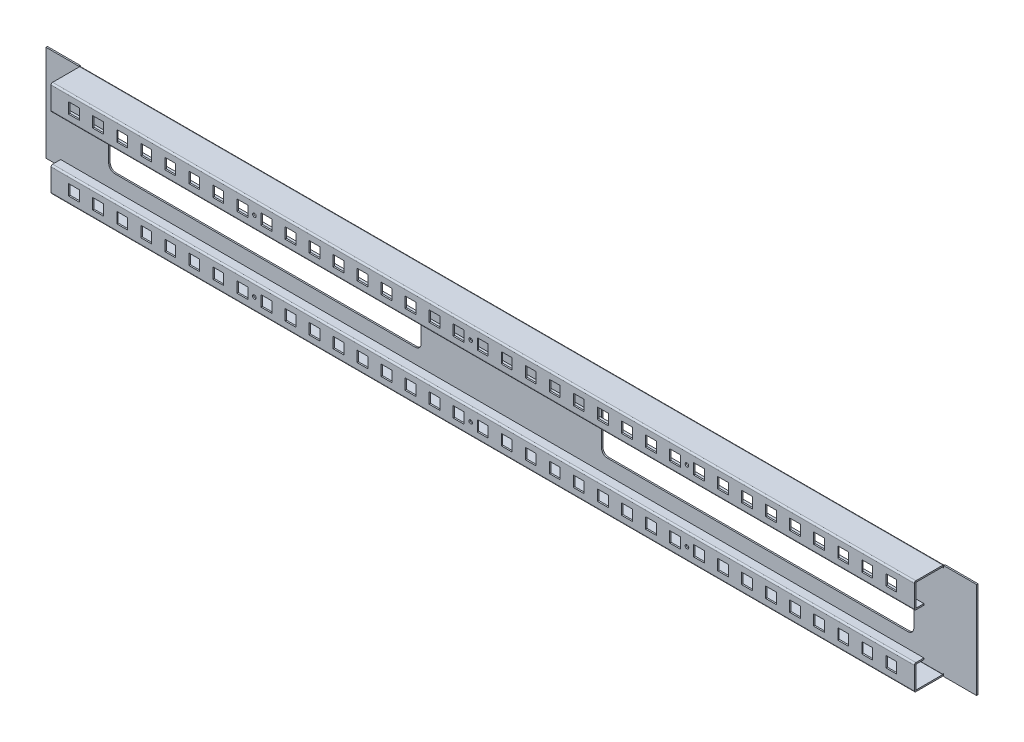
from build123d import *

# Parameters (mm, degrees)
SKETCH_1_W                          = 774.4
SKETCH_1_H                          = 80
SM_BASE_FLANGE_1_DEPTH              = 1.2
SM_EDGE_FLANGE_1_STRIP_W            = 5
SM_EDGE_FLANGE_1_STRIP_H            = 1.2
SM_EDGE_FLANGE_1_STRIP_CUT_DEPTH    = 718.4
SM_EDGE_FLANGE_1_RELIEF_W           = 5.6
SM_EDGE_FLANGE_1_RELIEF_H           = 0.6
SM_EDGE_FLANGE_1_RELIEF_CUT_DEPTH   = 1.2
SM_EDGE_FLANGE_1_STRIP_2_W          = 5
SM_EDGE_FLANGE_1_STRIP_2_H          = 1.2
SM_EDGE_FLANGE_1_STRIP_CUT_2_DEPTH  = 718.4
SM_EDGE_FLANGE_1_RELIEF_2_W         = 5.6
SM_EDGE_FLANGE_1_RELIEF_2_H         = 0.6
SM_EDGE_FLANGE_1_RELIEF_CUT_2_DEPTH = 1.2
SM_EDGE_FLANGE_1_DEPTH              = 718.4
SM_EDGE_FLANGE_1_BEND_DEPTH         = 718.4
SM_EDGE_FLANGE_2_STRIP_W            = 5
SM_EDGE_FLANGE_2_STRIP_H            = 1.2
SM_EDGE_FLANGE_2_STRIP_CUT_DEPTH    = 718.4
SM_EDGE_FLANGE_2_STRIP_2_W          = 5
SM_EDGE_FLANGE_2_STRIP_2_H          = 1.2
SM_EDGE_FLANGE_2_STRIP_CUT_2_DEPTH  = 718.4
SM_EDGE_FLANGE_2_DEPTH              = 718.4
SM_EDGE_FLANGE_2_BEND_DEPTH         = 718.4
SM_EDGE_FLANGE_3_STRIP_W            = 5
SM_EDGE_FLANGE_3_STRIP_H            = 1.2
SM_EDGE_FLANGE_3_STRIP_CUT_DEPTH    = 718.4
SM_EDGE_FLANGE_3_STRIP_2_W          = 5
SM_EDGE_FLANGE_3_STRIP_2_H          = 1.2
SM_EDGE_FLANGE_3_STRIP_CUT_2_DEPTH  = 718.4
SM_EDGE_FLANGE_3_DEPTH              = 718.4
SM_EDGE_FLANGE_3_BEND_DEPTH         = 718.4
SKETCH_26_W                         = 9
SKETCH_26_H                         = 9
CUT_EXTRUDE_1_DEPTH                 = 10
PATTERN_LINEAR_1_COUNT              = 18
PATTERN_LINEAR_1_PITCH              = 20
PATTERN_LINEAR_1_COL_COUNT          = 18
PATTERN_LINEAR_1_COL_PITCH          = 20
CUT_EXTRUDE_2_DEPTH                 = 10
SKETCH_28_R                         = 1.5
CUT_EXTRUDE_3_DEPTH                 = 10


# Sheet-metal steps are written as plain solids
with BuildPart() as part:
    # Sketch 1 → 基体-法兰1 (new body)
    with BuildSketch(Plane.XY):
        Rectangle(SKETCH_1_W, SKETCH_1_H)
    extrude(amount=-SM_BASE_FLANGE_1_DEPTH)

    # 边线-法兰1 strip (across the edge) → 边线-法兰1 strip cut (cut)
    with BuildSketch(Plane(origin=(359.2, 40, 0), x_dir=(0, -1, 0), z_dir=(-1, 0, 0))):
        with Locations((-1.2, -0.6)):
            Rectangle(SM_EDGE_FLANGE_1_STRIP_W, SM_EDGE_FLANGE_1_STRIP_H)
    extrude(amount=SM_EDGE_FLANGE_1_STRIP_CUT_DEPTH, mode=Mode.SUBTRACT)

    # 边线-法兰1 relief (on the sheet) → 边线-法兰1 relief cut (cut)
    with BuildSketch(Plane(origin=(359.2, 38.7, 0), x_dir=(0, -1, 0), z_dir=(0, 0, 1))):
        with Locations((-2.2, 0.3)):
            Rectangle(SM_EDGE_FLANGE_1_RELIEF_W, SM_EDGE_FLANGE_1_RELIEF_H)
        with Locations((-2.2, -718.7)):
            Rectangle(SM_EDGE_FLANGE_1_RELIEF_W, SM_EDGE_FLANGE_1_RELIEF_H)
    extrude(amount=-SM_EDGE_FLANGE_1_RELIEF_CUT_DEPTH, mode=Mode.SUBTRACT)

    # 边线-法兰1 strip 2 (across the edge) → 边线-法兰1 strip cut 2 (cut)
    with BuildSketch(Plane(origin=(-359.2, -40, 0), x_dir=(0, 1, 0), z_dir=(1, 0, 0))):
        with Locations((-1.2, -0.6)):
            Rectangle(SM_EDGE_FLANGE_1_STRIP_2_W, SM_EDGE_FLANGE_1_STRIP_2_H)
    extrude(amount=SM_EDGE_FLANGE_1_STRIP_CUT_2_DEPTH, mode=Mode.SUBTRACT)

    # 边线-法兰1 relief 2 (on the sheet) → 边线-法兰1 relief cut 2 (cut)
    with BuildSketch(Plane(origin=(-359.2, -38.7, 0), x_dir=(0, 1, 0), z_dir=(0, 0, 1))):
        with Locations((-2.2, 0.3)):
            Rectangle(SM_EDGE_FLANGE_1_RELIEF_2_W, SM_EDGE_FLANGE_1_RELIEF_2_H)
        with Locations((-2.2, -718.7)):
            Rectangle(SM_EDGE_FLANGE_1_RELIEF_2_W, SM_EDGE_FLANGE_1_RELIEF_2_H)
    extrude(amount=-SM_EDGE_FLANGE_1_RELIEF_CUT_2_DEPTH, mode=Mode.SUBTRACT)

    # 边线-法兰1 section (across the edge) → 边线-法兰1 (add)
    with BuildSketch(Plane(origin=(359.2, 40, 0), x_dir=(0, -1, 0), z_dir=(-1, 0, 0))):
        with BuildLine():
            Line((0, 0.1), (0, 23.8))
            Line((0, 23.8), (1.2, 23.8))
            Line((1.2, 23.8), (1.2, 0.1))
            ThreePointArc((1.2, 0.1), (1.229289322, 0.029289322), (1.3, 0))
            Line((1.3, 0), (1.3, -1.2))
            ThreePointArc((1.3, -1.2), (0.380761184, -0.819238816), (0, 0.1))
        make_face()
    extrude(amount=SM_EDGE_FLANGE_1_DEPTH)

    # 边线-法兰1 section 2 (across the edge) → 边线-法兰1 bend (add)
    with BuildSketch(Plane(origin=(-359.2, -40, 0), x_dir=(0, 1, 0), z_dir=(1, 0, 0))):
        with BuildLine():
            Line((0, 0.1), (0, 23.8))
            Line((0, 23.8), (1.2, 23.8))
            Line((1.2, 23.8), (1.2, 0.1))
            ThreePointArc((1.2, 0.1), (1.229289322, 0.029289322), (1.3, 0))
            Line((1.3, 0), (1.3, -1.2))
            ThreePointArc((1.3, -1.2), (0.380761184, -0.819238816), (0, 0.1))
        make_face()
    extrude(amount=SM_EDGE_FLANGE_1_BEND_DEPTH)

    # 边线-法兰2 strip (across the edge) → 边线-法兰2 strip cut (cut)
    with BuildSketch(Plane(origin=(359.2, 38.8, 23.8), x_dir=(0, 0, -1), z_dir=(-1, 0, 0))):
        with Locations((-1.2, -0.6)):
            Rectangle(SM_EDGE_FLANGE_2_STRIP_W, SM_EDGE_FLANGE_2_STRIP_H)
    extrude(amount=SM_EDGE_FLANGE_2_STRIP_CUT_DEPTH, mode=Mode.SUBTRACT)

    # 边线-法兰2 strip 2 (across the edge) → 边线-法兰2 strip cut 2 (cut)
    with BuildSketch(Plane(origin=(-359.2, -38.8, 23.8), x_dir=(0, 0, -1), z_dir=(1, 0, 0))):
        with Locations((-1.2, -0.6)):
            Rectangle(SM_EDGE_FLANGE_2_STRIP_2_W, SM_EDGE_FLANGE_2_STRIP_2_H)
    extrude(amount=SM_EDGE_FLANGE_2_STRIP_CUT_2_DEPTH, mode=Mode.SUBTRACT)

    # 边线-法兰2 section (across the edge) → 边线-法兰2 (add)
    with BuildSketch(Plane(origin=(359.2, 38.8, 23.8), x_dir=(0, 0, -1), z_dir=(-1, 0, 0))):
        with BuildLine():
            Line((0, 0.1), (0, 19.8))
            Line((0, 19.8), (1.2, 19.8))
            Line((1.2, 19.8), (1.2, 0.1))
            ThreePointArc((1.2, 0.1), (1.229289322, 0.029289322), (1.3, 0))
            Line((1.3, 0), (1.3, -1.2))
            ThreePointArc((1.3, -1.2), (0.380761184, -0.819238816), (0, 0.1))
        make_face()
    extrude(amount=SM_EDGE_FLANGE_2_DEPTH)

    # 边线-法兰2 section 2 (across the edge) → 边线-法兰2 bend (add)
    with BuildSketch(Plane(origin=(-359.2, -38.8, 23.8), x_dir=(0, 0, -1), z_dir=(1, 0, 0))):
        with BuildLine():
            Line((0, 0.1), (0, 19.8))
            Line((0, 19.8), (1.2, 19.8))
            Line((1.2, 19.8), (1.2, 0.1))
            ThreePointArc((1.2, 0.1), (1.229289322, 0.029289322), (1.3, 0))
            Line((1.3, 0), (1.3, -1.2))
            ThreePointArc((1.3, -1.2), (0.380761184, -0.819238816), (0, 0.1))
        make_face()
    extrude(amount=SM_EDGE_FLANGE_2_BEND_DEPTH)

    # 边线-法兰3 strip (across the edge) → 边线-法兰3 strip cut (cut)
    with BuildSketch(Plane(origin=(359.2, 19, 22.6), x_dir=(0, 1, 0), z_dir=(-1, 0, 0))):
        with Locations((-1.2, -0.6)):
            Rectangle(SM_EDGE_FLANGE_3_STRIP_W, SM_EDGE_FLANGE_3_STRIP_H)
    extrude(amount=SM_EDGE_FLANGE_3_STRIP_CUT_DEPTH, mode=Mode.SUBTRACT)

    # 边线-法兰3 strip 2 (across the edge) → 边线-法兰3 strip cut 2 (cut)
    with BuildSketch(Plane(origin=(-359.2, -19, 22.6), x_dir=(0, -1, 0), z_dir=(1, 0, 0))):
        with Locations((-1.2, -0.6)):
            Rectangle(SM_EDGE_FLANGE_3_STRIP_2_W, SM_EDGE_FLANGE_3_STRIP_2_H)
    extrude(amount=SM_EDGE_FLANGE_3_STRIP_CUT_2_DEPTH, mode=Mode.SUBTRACT)

    # 边线-法兰3 section (across the edge) → 边线-法兰3 (add)
    with BuildSketch(Plane(origin=(359.2, 19, 22.6), x_dir=(0, 1, 0), z_dir=(-1, 0, 0))):
        with BuildLine():
            Line((0, 0.1), (0, 6.8))
            Line((0, 6.8), (1.2, 6.8))
            Line((1.2, 6.8), (1.2, 0.1))
            ThreePointArc((1.2, 0.1), (1.229289322, 0.029289322), (1.3, 0))
            Line((1.3, 0), (1.3, -1.2))
            ThreePointArc((1.3, -1.2), (0.380761184, -0.819238816), (0, 0.1))
        make_face()
    extrude(amount=SM_EDGE_FLANGE_3_DEPTH)

    # 边线-法兰3 section 2 (across the edge) → 边线-法兰3 bend (add)
    with BuildSketch(Plane(origin=(-359.2, -19, 22.6), x_dir=(0, -1, 0), z_dir=(1, 0, 0))):
        with BuildLine():
            Line((0, 0.1), (0, 6.8))
            Line((0, 6.8), (1.2, 6.8))
            Line((1.2, 6.8), (1.2, 0.1))
            ThreePointArc((1.2, 0.1), (1.229289322, 0.029289322), (1.3, 0))
            Line((1.3, 0), (1.3, -1.2))
            ThreePointArc((1.3, -1.2), (0.380761184, -0.819238816), (0, 0.1))
        make_face()
    extrude(amount=SM_EDGE_FLANGE_3_BEND_DEPTH)

    # 草图26 → 切除-拉伸1 (cut)
    with BuildSketch(Plane.XY.offset(23.8)):
        with Locations((0, 29.5)):
            Rectangle(SKETCH_26_W, SKETCH_26_H)
        with Locations((0, -29.5)):
            Rectangle(SKETCH_26_W, SKETCH_26_H)
    cut_extrude_1 = extrude(amount=-CUT_EXTRUDE_1_DEPTH, mode=Mode.SUBTRACT)

    # 阵列(线性)1: 切除-拉伸1 ×18
    with Locations(*[(-i * PATTERN_LINEAR_1_PITCH, 0, 0) for i in range(1, PATTERN_LINEAR_1_COUNT)]):
        add(cut_extrude_1, mode=Mode.SUBTRACT)

    # 阵列(线性)1 col: 切除-拉伸1 ×18
    with Locations(*[(i * PATTERN_LINEAR_1_COL_PITCH, 0, 0) for i in range(1, PATTERN_LINEAR_1_COL_COUNT)]):
        add(cut_extrude_1, mode=Mode.SUBTRACT)

    # 草图27 → 切除-拉伸2 (cut)
    with BuildSketch(Plane(origin=(0, 0, -1.2), x_dir=(-1, 0, 0), z_dir=(0, 0, -1))):
        with BuildLine():
            Line((-330, 22.5), (-80, 22.5))
            ThreePointArc((-80, 22.5), (-76.464466094, 21.035533906), (-75, 17.5))
            Line((-75, 17.5), (-75, -17.5))
            ThreePointArc((-75, -17.5), (-76.464466094, -21.035533906), (-80, -22.5))
            Line((-80, -22.5), (-330, -22.5))
            ThreePointArc((-330, -22.5), (-333.535533906, -21.035533906), (-335, -17.5))
            Line((-335, -17.5), (-335, 17.5))
            ThreePointArc((-335, 17.5), (-333.535533906, 21.035533906), (-330, 22.5))
        make_face()
    cut_extrude_2 = extrude(amount=-CUT_EXTRUDE_2_DEPTH, mode=Mode.SUBTRACT)

    # 镜向1: 切除-拉伸2 across plane
    add(cut_extrude_2.mirror(Plane(origin=(0, 0, 0), x_dir=(0, 0, 1), z_dir=(1, 0, 0))), mode=Mode.SUBTRACT)

    # 草图28 → 切除-拉伸3 (cut)
    with BuildSketch(Plane.XY.offset(23.8)):
        with Locations((-190, -29.5)):
            Circle(SKETCH_28_R)
        with Locations((-10, -29.5)):
            Circle(SKETCH_28_R)
        with Locations((170, -29.5)):
            Circle(SKETCH_28_R)
        with Locations(Location((170, 29.5, 0), (0, 0, 270))):
            Circle(SKETCH_28_R)
        with Locations(Location((-10, 29.5, 0), (0, 0, 270))):
            Circle(SKETCH_28_R)
        with Locations(Location((-190, 29.5, 0), (0, 0, 270))):
            Circle(SKETCH_28_R)
    extrude(amount=-CUT_EXTRUDE_3_DEPTH, mode=Mode.SUBTRACT)


solid = part.part
